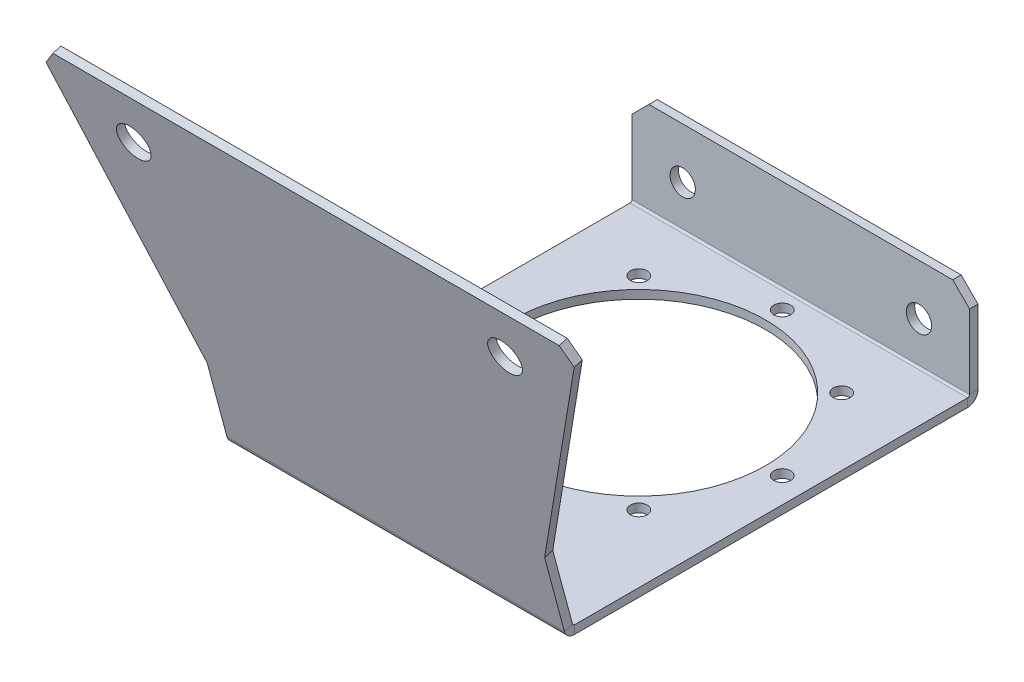
from build123d import *

# Parameters (mm, degrees)
SKETCH1_W                    = 127
SKETCH1_H                    = 38.1
BASE_FLANGE1_DEPTH           = 3.175
EDGE_FLANGE1_STRIP_W         = 14.1732
EDGE_FLANGE1_STRIP_H         = 3.175
EDGE_FLANGE1_STRIP_CUT_DEPTH = 127
EDGE_FLANGE1_DEPTH           = 127
SKETCH9_R                    = 3.175
SKETCH9_R_2                  = 47.625
CUT_EXTRUDE1_DEPTH           = 169.868266273
EDGE_FLANGE2_START           = -63.5
EDGE_FLANGE2_DEPTH           = 127
EDGE_FLANGE2_2_DEPTH         = 127
TAB1_DEPTH                   = 3.175
SKETCH16_R                   = 6.35
CUT_EXTRUDE2_DEPTH           = 235.714429908
BREAK_CORNER1_START          = -171.342480702
BREAK_CORNER1_OUTLINE_W      = 10
BREAK_CORNER1_OUTLINE_H      = 6
BREAK_CORNER1_DEPTH          = 5.219227672
BREAK_CORNER1_START_2        = 166.12325303
BREAK_CORNER1_2_OUTLINE_W    = 10
BREAK_CORNER1_2_OUTLINE_H    = 6
BREAK_CORNER1_2_DEPTH        = 5.219227672
BREAK_CORNER1_START_3        = 53.881536726
BREAK_CORNER1_3_OUTLINE_W    = 12
BREAK_CORNER1_3_OUTLINE_H    = 6
BREAK_CORNER1_3_DEPTH        = 4.490128061
BREAK_CORNER1_START_4        = -58.371664787
BREAK_CORNER1_4_OUTLINE_W    = 12
BREAK_CORNER1_4_OUTLINE_H    = 6
BREAK_CORNER1_4_DEPTH        = 4.490128061
SKETCH17_R                   = 4.7625
CUT_EXTRUDE3_DEPTH           = 239.261598489


# Read off the part's stored shape, not the designer's step: Edge-Flange2, Break-Corner1
# Sheet-metal steps are written as plain solids
with BuildPart() as part:
    # Sketch1 → Base-Flange1 (new body)
    with BuildSketch(Plane.XY):
        Rectangle(SKETCH1_W, SKETCH1_H)
    extrude(amount=-BASE_FLANGE1_DEPTH)

    # Edge-Flange1 strip (across the edge) → Edge-Flange1 strip cut (cut)
    with BuildSketch(Plane(origin=(-63.5, -19.05, 0), x_dir=(0, 1, 0), z_dir=(1, 0, 0))):
        with Locations((-3.175, -1.5875)):
            Rectangle(EDGE_FLANGE1_STRIP_W, EDGE_FLANGE1_STRIP_H)
    extrude(amount=EDGE_FLANGE1_STRIP_CUT_DEPTH, mode=Mode.SUBTRACT)

    # Edge-Flange1 section (across the edge) → Edge-Flange1 (add)
    with BuildSketch(Plane(origin=(-63.5, -19.05, 0), x_dir=(0, 1, 0), z_dir=(1, 0, 0))):
        with BuildLine():
            Line((0, 0.7366), (0, 152.527))
            Line((0, 152.527), (3.175, 152.527))
            Line((3.175, 152.527), (3.175, 0.7366))
            ThreePointArc((3.175, 0.7366), (3.390745145, 0.215745145), (3.9116, 0))
            Line((3.9116, 0), (3.9116, -3.175))
            ThreePointArc((3.9116, -3.175), (1.145681115, -2.029318885), (0, 0.7366))
        make_face()
    extrude(amount=EDGE_FLANGE1_DEPTH)

    # Sketch9 → Cut-Extrude1 (cut, through all)
    with BuildSketch(Plane(origin=(0, -15.875, 0), x_dir=(1, 0, 0), z_dir=(0, 1, 0))):
        with Locations(Location((0, -6.985, 0), (0, 0, 270))):
            Circle(SKETCH9_R)
        with Locations(Location((38.166088515, -22.793911485, 0), (0, 0, 270))):
            Circle(SKETCH9_R)
        with Locations(Location((53.975, -60.96, 0), (0, 0, 270))):
            Circle(SKETCH9_R)
        with Locations(Location((38.166088515, -99.126088515, 0), (0, 0, 270))):
            Circle(SKETCH9_R)
        with Locations(Location((0, -114.935, 0), (0, 0, 270))):
            Circle(SKETCH9_R)
        with Locations(Location((-38.166088515, -99.126088515, 0), (0, 0, 270))):
            Circle(SKETCH9_R)
        with Locations(Location((-53.975, -60.96, 0), (0, 0, 270))):
            Circle(SKETCH9_R)
        with Locations(Location((-38.166088515, -22.793911485, 0), (0, 0, 270))):
            Circle(SKETCH9_R)
        with Locations(Location((0, -60.96, 0), (0, 0, 270))):
            Circle(SKETCH9_R_2)
    extrude(amount=-CUT_EXTRUDE1_DEPTH, mode=Mode.SUBTRACT)

    # Edge-Flange2 outline → Edge-Flange2 (cut)
    with BuildSketch(Plane.YZ.offset(EDGE_FLANGE2_START)):
        with BuildLine():
            ThreePointArc((-19.05, 148.674785068), (-18.241680926, 151.056016274), (-16.150796577, 152.45310053))
            Line((-16.150796577, 152.45310053), (-15.875, 152.527))
            Line((-15.875, 152.527), (-19.05, 152.527))
            Line((-19.05, 152.527), (-19.05, 148.674785068))
        make_face()
    extrude(amount=EDGE_FLANGE2_DEPTH, mode=Mode.SUBTRACT)

    # Edge-Flange2 2 outline → Edge-Flange2 2 (add)
    with BuildSketch(Plane.YZ.offset(EDGE_FLANGE2_START)):
        with BuildLine():
            Line((109.756208936, 186.189780978), (-15.875, 152.527))
            Line((-15.875, 152.527), (-15.875, 148.674785068))
            ThreePointArc((-15.875, 148.674785068), (-15.72278407, 149.123198736), (-15.329046109, 149.386286031))
            Line((-15.329046109, 149.386286031), (110.577959404, 183.12296648))
            Line((110.577959404, 183.12296648), (109.756208936, 186.189780978))
        make_face()
    extrude(amount=EDGE_FLANGE2_2_DEPTH)

    # Sketch13 → Tab1 (add)
    with BuildSketch(Plane(origin=(0, -39.195173357, 146.278378382), x_dir=(1, 0, 0), z_dir=(0, -0.258819045102528, 0.9659258262890663))):
        Polygon((-63.5, 154.205818127), (-101.6, 154.205818127), (-63.5, 52.605818127), align=None)
        Polygon((101.6, 154.205818127), (63.5, 52.605818127), (63.5, 154.205818127), align=None)
    extrude(amount=-TAB1_DEPTH)

    # Sketch16 → Cut-Extrude2 (cut, through all)
    with BuildSketch(Plane(origin=(0, -39.195173357, 146.278378382), x_dir=(1, 0, 0), z_dir=(0, -0.258819045102528, 0.9659258262890663))):
        with Locations(Location((69.85, 134.705637142, 0), (0, 0, 270))):
            Circle(SKETCH16_R)
        with Locations(Location((-69.85, 134.705637142, 0), (0, 0, 270))):
            Circle(SKETCH16_R)
    extrude(amount=-CUT_EXTRUDE2_DEPTH, mode=Mode.SUBTRACT)

    # Break-Corner1 outline → Break-Corner1 (cut)
    with BuildSketch(Plane(origin=(0, 0, 0), x_dir=(0.5695948377626004, 0.7939191812855688, 0.212730003481053), z_dir=(0.8219256175556257, -0.5501863643158269, -0.14742199200504597)).offset(BREAK_CORNER1_START)):
        with Locations((69, 150)):
            Rectangle(BREAK_CORNER1_OUTLINE_W, BREAK_CORNER1_OUTLINE_H)
    extrude(amount=BREAK_CORNER1_DEPTH, mode=Mode.SUBTRACT)

    # Break-Corner1 2 outline → Break-Corner1 2 (cut)
    with BuildSketch(Plane(origin=(0, 0, 0), x_dir=(0.5695948377626027, -0.7939191812855675, -0.21273000348105187), z_dir=(0.8219256175556241, 0.5501863643158292, 0.14742199200504602)).offset(BREAK_CORNER1_START_2)):
        with Locations((-69, -150)):
            Rectangle(BREAK_CORNER1_2_OUTLINE_W, BREAK_CORNER1_2_OUTLINE_H)
    extrude(amount=BREAK_CORNER1_2_DEPTH, mode=Mode.SUBTRACT)

    # Break-Corner1 3 outline → Break-Corner1 3 (cut)
    with BuildSketch(Plane(origin=(0, 0, 0), x_dir=(0.707106781186548, -0.707106781186547, 0), z_dir=(0.707106781186547, 0.707106781186548, 0)).offset(BREAK_CORNER1_START_3)):
        with Locations((31, 2)):
            Rectangle(BREAK_CORNER1_3_OUTLINE_W, BREAK_CORNER1_3_OUTLINE_H)
    extrude(amount=BREAK_CORNER1_3_DEPTH, mode=Mode.SUBTRACT)

    # Break-Corner1 4 outline → Break-Corner1 4 (cut)
    with BuildSketch(Plane(origin=(0, 0, 0), x_dir=(0.7071067811865474, 0.7071067811865477, 0), z_dir=(0.7071067811865476, -0.7071067811865476, 0)).offset(BREAK_CORNER1_START_4)):
        with Locations((-31, -2)):
            Rectangle(BREAK_CORNER1_4_OUTLINE_W, BREAK_CORNER1_4_OUTLINE_H)
    extrude(amount=BREAK_CORNER1_4_DEPTH, mode=Mode.SUBTRACT)

    # Sketch17 → Cut-Extrude3 (cut, through all)
    with BuildSketch(Plane.XY):
        with Locations((44.45, 0)):
            Circle(SKETCH17_R)
        with Locations((-44.45, 0)):
            Circle(SKETCH17_R)
    extrude(amount=-CUT_EXTRUDE3_DEPTH, mode=Mode.SUBTRACT)


solid = part.part
